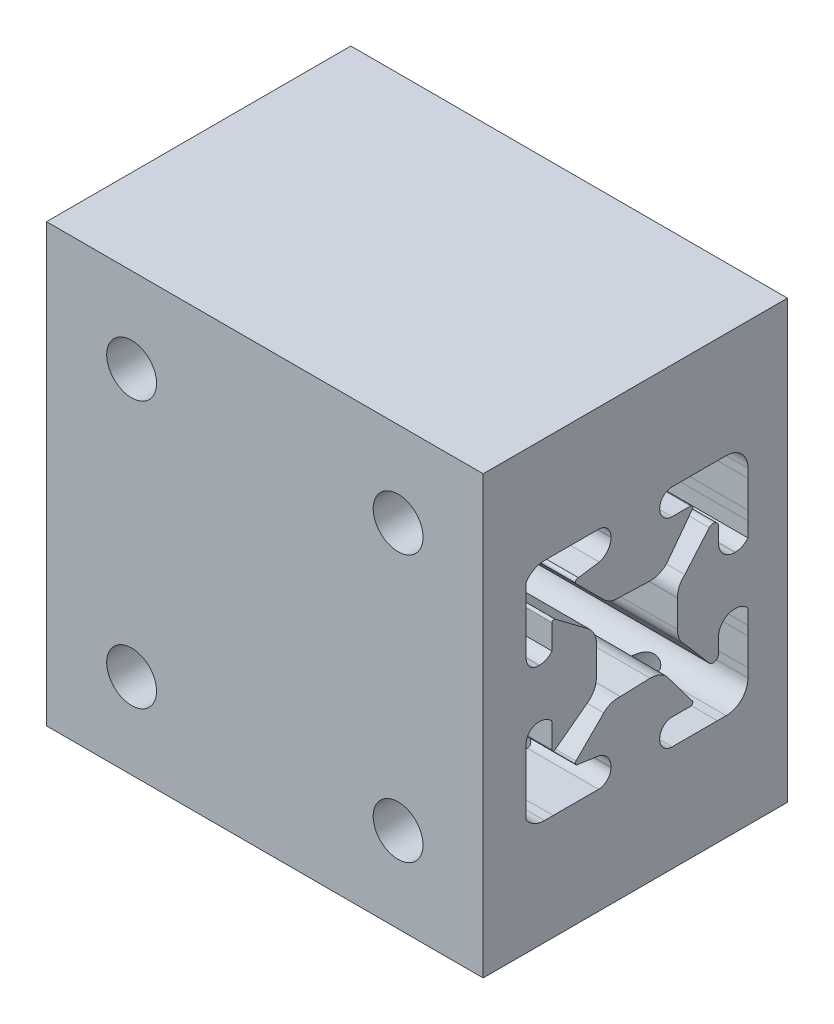
from build123d import *

# Parameters (mm, degrees)
SKETCH1_W           = 50.8
SKETCH1_H           = 50.8
SKETCH1_R           = 2.9
BOSS_EXTRUDE1_DEPTH = 5
BOSS_EXTRUDE2_START = -25.4
BOSS_EXTRUDE2_DEPTH = 50.8
SKETCH5_R           = 2.9
CUT_EXTRUDE1_DEPTH  = 51.432929595


# Read off the part's stored shape, not the designer's step: Boss-Extrude2
with BuildPart() as part:
    # Sketch1 → Boss-Extrude1 (new body)
    with BuildSketch(Plane.XY):
        Rectangle(SKETCH1_W, SKETCH1_H)
        with Locations((-15.5, 15.5)):
            Circle(SKETCH1_R, mode=Mode.SUBTRACT)
        with Locations((15.5, 15.5)):
            Circle(SKETCH1_R, mode=Mode.SUBTRACT)
        with Locations((15.5, -15.5)):
            Circle(SKETCH1_R, mode=Mode.SUBTRACT)
        with Locations((-15.5, -15.5)):
            Circle(SKETCH1_R, mode=Mode.SUBTRACT)
    extrude(amount=BOSS_EXTRUDE1_DEPTH)

    # Boss-Extrude2 outline → Boss-Extrude2 (add)
    with BuildSketch(Plane(origin=(0, 0, 0), x_dir=(0, 0, -1), z_dir=(1, 0, 0)).offset(BOSS_EXTRUDE2_START)):
        with BuildLine():
            Line((0, -25.4), (30.400005474, -25.4))
            Line((30.400005474, -25.4), (30.400005474, 25.4))
            Line((30.400005474, 25.4), (0, 25.4))
            Line((0, 25.4), (0, 11.950681893))
            ThreePointArc((0, 11.950681893), (0.919780121, 12.8005837), (2.135826799, 13.099847846))
            Line((2.135826799, 13.099847846), (3.149526862, 13.1))
            Line((3.149526862, 13.1), (8.412487593, 13.1))
            ThreePointArc((8.412487593, 13.1), (9.437094092, 12.675594092), (9.8615, 11.650987593))
            Line((9.8615, 11.650987593), (9.8615, 11.539212407))
            ThreePointArc((9.8615, 11.539212407), (9.483642446, 10.419145319), (8.504505016, 9.75686403))
            Line((8.504505016, 9.75686403), (6.079915642, 9.395766402))
            ThreePointArc((6.079915642, 9.395766402), (5.759795632, 9.269646327), (5.802934283, 8.928292916))
            Line((5.802934283, 8.928292916), (9.030314529, 5.706790908))
            ThreePointArc((9.030314529, 5.706790908), (9.925576978, 5.145337842), (10.975774635, 5.027824954))
            Line((10.975774635, 5.027824954), (14.409253557, 4.8958))
            ThreePointArc((14.409253557, 4.8958), (15.470031519, 5.106550575), (16.369685471, 5.706790908))
            Line((16.369685471, 5.706790908), (19.25062672, 9.563668371))
            ThreePointArc((19.25062672, 9.563668371), (19.38809295, 9.87908259), (19.116408329, 10.0902))
            Line((19.116408329, 10.0902), (16.987512407, 10.0902))
            ThreePointArc((16.987512407, 10.0902), (15.962905908, 10.514605908), (15.5385, 11.539212407))
            Line((15.5385, 11.539212407), (15.5385, 11.650987593))
            ThreePointArc((15.5385, 11.650987593), (15.962905908, 12.675594092), (16.987512407, 13.1))
            Line((16.987512407, 13.1), (22.250473138, 13.1))
            Line((22.250473138, 13.1), (23.264173201, 13.099847846))
            ThreePointArc((23.264173201, 13.099847846), (25.065381858, 12.365348599), (25.799847328, 10.564126169))
            Line((25.799847328, 10.564126169), (25.799999481, 9.550429917))
            Line((25.799999481, 9.550429917), (25.799997837, 6.333083395))
            Line((25.799997837, 6.333083395), (25.799973902, 5.258893448))
            Line((25.799973902, 5.258893448), (25.799973902, 3.538895087))
            ThreePointArc((25.799973902, 3.538895087), (25.155677983, 3.022750113), (24.350968068, 2.838454649))
            Line((24.350968068, 2.838454649), (24.239192883, 2.838454411))
            ThreePointArc((24.239192883, 2.838454411), (22.931741126, 3.380016215), (22.390176539, 4.687466818))
            Line((22.390176539, 4.687466818), (22.390176539, 6.402082132))
            ThreePointArc((22.390176539, 6.402082132), (21.990745466, 6.986607322), (21.30103494, 6.826875453))
            Line((21.30103494, 6.826875453), (18.455727795, 3.503720166))
            ThreePointArc((18.455727795, 3.503720166), (17.813480003, 2.648869687), (17.608483113, 1.599475651))
            Line((17.608483113, 1.599475651), (17.608483126, 1.593202094))
            Line((17.608483126, 1.593202094), (17.608483113, -1.599475651))
            ThreePointArc((17.608483113, -1.599475651), (17.813480003, -2.648869687), (18.455727795, -3.503720166))
            Line((18.455727795, -3.503720166), (21.30103494, -6.826875453))
            ThreePointArc((21.30103494, -6.826875453), (21.990745466, -6.986607322), (22.390176539, -6.402082132))
            Line((22.390176539, -6.402082132), (22.390176539, -4.687466818))
            ThreePointArc((22.390176539, -4.687466818), (22.931741126, -3.380016215), (24.239192883, -2.838454411))
            Line((24.239192883, -2.838454411), (24.350968068, -2.838454649))
            ThreePointArc((24.350968068, -2.838454649), (25.155677983, -3.022750113), (25.799973902, -3.538895087))
            Line((25.799973902, -3.538895087), (25.799973902, -5.258888992))
            Line((25.799973902, -5.258888992), (25.799997837, -6.33308775))
            Line((25.799997837, -6.33308775), (25.799999481, -9.550429917))
            Line((25.799999481, -9.550429917), (25.799847328, -10.564126169))
            ThreePointArc((25.799847328, -10.564126169), (25.065381858, -12.365348599), (23.264173201, -13.099847846))
            Line((23.264173201, -13.099847846), (22.250473138, -13.1))
            Line((22.250473138, -13.1), (16.987512407, -13.1))
            ThreePointArc((16.987512407, -13.1), (15.962905908, -12.675594092), (15.5385, -11.650987593))
            Line((15.5385, -11.650987593), (15.5385, -11.539212407))
            ThreePointArc((15.5385, -11.539212407), (15.962905908, -10.514605908), (16.987512407, -10.0902))
            Line((16.987512407, -10.0902), (19.116408329, -10.0902))
            ThreePointArc((19.116408329, -10.0902), (19.38809295, -9.87908259), (19.25062672, -9.563668371))
            Line((19.25062672, -9.563668371), (16.369685471, -5.706790908))
            ThreePointArc((16.369685471, -5.706790908), (15.470031519, -5.106550575), (14.409253557, -4.8958))
            Line((14.409253557, -4.8958), (10.975774635, -5.027824954))
            ThreePointArc((10.975774635, -5.027824954), (9.925576978, -5.145337842), (9.030314529, -5.706790908))
            Line((9.030314529, -5.706790908), (5.802934283, -8.928292916))
            ThreePointArc((5.802934283, -8.928292916), (5.759795632, -9.269646327), (6.079915642, -9.395766402))
            Line((6.079915642, -9.395766402), (8.504505016, -9.75686403))
            ThreePointArc((8.504505016, -9.75686403), (9.483642446, -10.419145319), (9.8615, -11.539212407))
            Line((9.8615, -11.539212407), (9.8615, -11.650987593))
            ThreePointArc((9.8615, -11.650987593), (9.437094092, -12.675594092), (8.412487593, -13.1))
            Line((8.412487593, -13.1), (3.149526862, -13.1))
            Line((3.149526862, -13.1), (2.135826799, -13.099847846))
            ThreePointArc((2.135826799, -13.099847846), (0.919780121, -12.8005837), (0, -11.950681893))
            Line((0, -11.950681893), (0, -25.4))
        make_face()
        with BuildLine():
            Line((0, 4.287469289), (0, -4.287469289))
            ThreePointArc((0, -4.287469289), (0.424405908, -3.26286279), (1.449012407, -2.838456882))
            Line((1.449012407, -2.838456882), (1.560787593, -2.838456882))
            ThreePointArc((1.560787593, -2.838456882), (2.365501583, -3.022752413), (3.0098, -3.538900647))
            Line((3.0098, -3.538900647), (3.0098, -6.402089023))
            ThreePointArc((3.0098, -6.402089023), (3.171299887, -6.619738927), (3.426415603, -6.52825305))
            Line((3.426415603, -6.52825305), (7.376475217, -3.557649208))
            ThreePointArc((7.376475217, -3.557649208), (7.97965784, -2.656597206), (8.1915, -1.593184358))
            Line((8.1915, -1.593184358), (8.1915, 1.593184358))
            ThreePointArc((8.1915, 1.593184358), (7.97965784, 2.656597206), (7.376475217, 3.557649208))
            Line((7.376475217, 3.557649208), (3.426415603, 6.52825305))
            ThreePointArc((3.426415603, 6.52825305), (3.171299887, 6.619738927), (3.0098, 6.402089023))
            Line((3.0098, 6.402089023), (3.0098, 3.538900647))
            ThreePointArc((3.0098, 3.538900647), (2.365501583, 3.022752413), (1.560787593, 2.838456882))
            Line((1.560787593, 2.838456882), (1.449012407, 2.838456882))
            ThreePointArc((1.449012407, 2.838456882), (0.424405908, 3.26286279), (0, 4.287469289))
        make_face()
    extrude(amount=BOSS_EXTRUDE2_DEPTH)

    # Sketch5 → Cut-Extrude1 (cut, through all)
    with BuildSketch(Plane.XY.offset(5)):
        with Locations((-15.5, -15.5)):
            Circle(SKETCH5_R)
        with Locations((15.5, -15.5)):
            Circle(SKETCH5_R)
        with Locations((15.5, 15.5)):
            Circle(SKETCH5_R)
        with Locations((-15.5, 15.5)):
            Circle(SKETCH5_R)
    extrude(amount=-CUT_EXTRUDE1_DEPTH, mode=Mode.SUBTRACT)


solid = part.part
